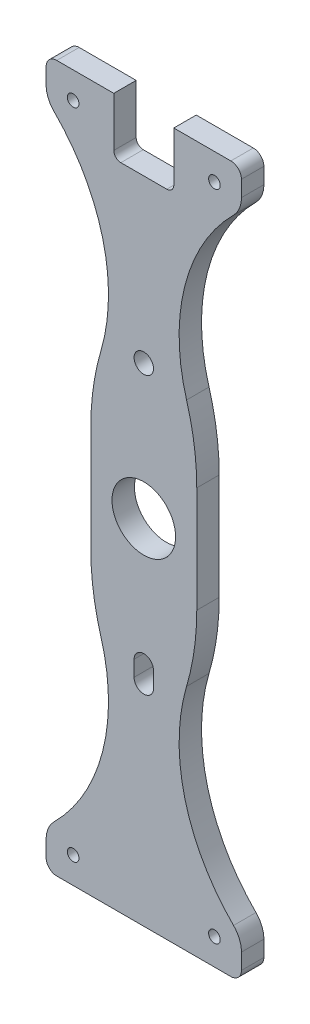
from build123d import *

# Parameters (mm, degrees)
SKETCH1_R           = 9
SKETCH1_R_2         = 2.75
SKETCH1_R_3         = 1.65
BOSS_EXTRUDE1_DEPTH = 6.35
CUT_EXTRUDE1_DEPTH  = 10


with BuildPart() as part:
    # Sketch1 → Boss-Extrude1 (new body)
    with BuildSketch(Plane.XY):
        with BuildLine():
            Line((-15, 15), (-15, -15))
            ThreePointArc((-15, -15), (-14.275727836, -25.159324804), (-12.117561222, -35.113156605))
            ThreePointArc((-12.117561222, -35.113156605), (-11.640196728, -62.923473964), (-25.409366876, -87.090633124))
            ThreePointArc((-25.409366876, -87.090633124), (-27.067678424, -89.572471742), (-27.65, -92.5))
            Line((-27.65, -92.5), (-27.65, -97))
            ThreePointArc((-27.65, -97), (-26.771320344, -99.121320344), (-24.65, -100))
            Line((-24.65, -100), (24.65, -100))
            ThreePointArc((24.65, -100), (26.771320344, -99.121320344), (27.65, -97))
            Line((27.65, -97), (27.65, -92.5))
            ThreePointArc((27.65, -92.5), (27.067678424, -89.572471742), (25.409366876, -87.090633124))
            ThreePointArc((25.409366876, -87.090633124), (11.640196728, -62.923473964), (12.117561222, -35.113156605))
            ThreePointArc((12.117561222, -35.113156605), (14.275727836, -25.159324804), (15, -15))
            Line((15, -15), (15, 15))
            ThreePointArc((15, 15), (14.275727836, 25.159324804), (12.117561222, 35.113156605))
            ThreePointArc((12.117561222, 35.113156605), (11.640196728, 62.923473964), (25.409366876, 87.090633124))
            ThreePointArc((25.409366876, 87.090633124), (27.067678424, 89.572471742), (27.65, 92.5))
            Line((27.65, 92.5), (27.65, 97))
            ThreePointArc((27.65, 97), (26.771320344, 99.121320344), (24.65, 100))
            Line((24.65, 100), (-24.65, 100))
            ThreePointArc((-24.65, 100), (-26.771320344, 99.121320344), (-27.65, 97))
            Line((-27.65, 97), (-27.65, 92.5))
            ThreePointArc((-27.65, 92.5), (-27.067678424, 89.572471742), (-25.409366876, 87.090633124))
            ThreePointArc((-25.409366876, 87.090633124), (-11.640196728, 62.923473964), (-12.117561222, 35.113156605))
            ThreePointArc((-12.117561222, 35.113156605), (-14.275727836, 25.159324804), (-15, 15))
        make_face()
        Circle(SKETCH1_R, mode=Mode.SUBTRACT)
        with Locations((0, 38.1)):
            Circle(SKETCH1_R_2, mode=Mode.SUBTRACT)
        with Locations((20, 92.5)):
            Circle(SKETCH1_R_3, mode=Mode.SUBTRACT)
        with Locations((-20, 92.5)):
            Circle(SKETCH1_R_3, mode=Mode.SUBTRACT)
        with Locations((-20, -92.5)):
            Circle(SKETCH1_R_3, mode=Mode.SUBTRACT)
        with Locations((20, -92.5)):
            Circle(SKETCH1_R_3, mode=Mode.SUBTRACT)
        with BuildLine():
            Line((2.75, -35.8890625), (2.75, -40.3109375))
            ThreePointArc((2.75, -40.3109375), (0, -43.0609375), (-2.75, -40.3109375))
            Line((-2.75, -40.3109375), (-2.75, -35.8890625))
            ThreePointArc((-2.75, -35.8890625), (0, -33.1390625), (2.75, -35.8890625))
        make_face(mode=Mode.SUBTRACT)
    extrude(amount=BOSS_EXTRUDE1_DEPTH)

    # Sketch3 → Cut-Extrude1 (cut)
    with BuildSketch(Plane.XY.offset(6.35)):
        with BuildLine():
            Line((-8.5, 101), (-8.5, 86))
            ThreePointArc((-8.5, 86), (-7.914213562, 84.585786438), (-6.5, 84))
            Line((-6.5, 84), (6.5, 84))
            ThreePointArc((6.5, 84), (7.914213562, 84.585786438), (8.5, 86))
            Line((8.5, 86), (8.5, 101))
            Line((8.5, 101), (-8.5, 101))
        make_face()
    extrude(amount=-CUT_EXTRUDE1_DEPTH, mode=Mode.SUBTRACT)


solid = part.part
